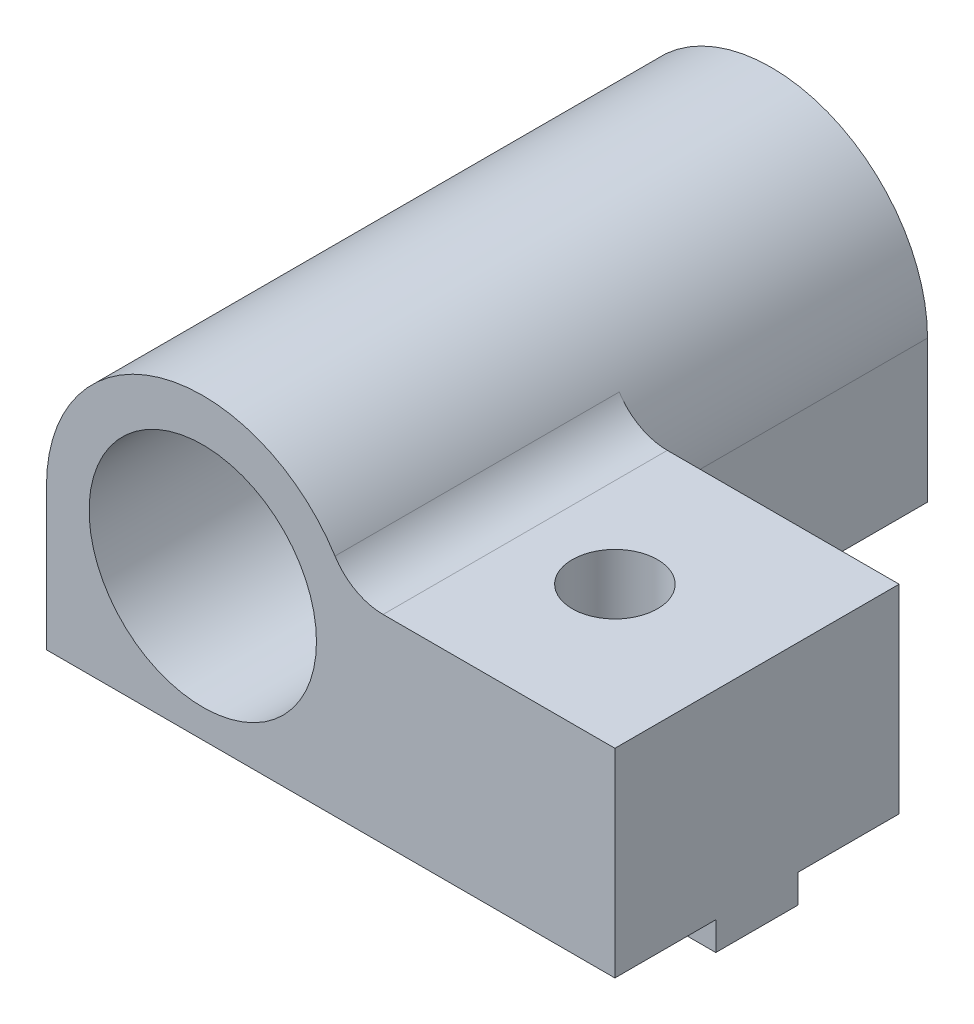
from build123d import *

# Parameters (mm, degrees)
SKETCH1_R                       = 4
MAIN_DEPTH                      = 10
SKETCH3_W                       = 20
SKETCH3_H                       = 2.9
MAKERBEAMRECTANGULARGUIDE_DEPTH = 1
SKETCH4_R                       = 1.5
MAKERBEAMFIXHOLE_DEPTH          = 20.345542122
FILLET1_R                       = 2
SKETCH5_R                       = 4
BOSS_EXTRUDE1_DEPTH             = 10
SKETCH6_W                       = 46.055005367
SKETCH6_H                       = 38.791045171
CUT_EXTRUDE1_DEPTH              = 30.516944286


with BuildPart() as part:
    # Sketch1 → Main (new body)
    with BuildSketch(Plane.XY):
        with BuildLine():
            Line((-5.5, 0), (-5.5, -5))
            Line((-5.5, -5), (14.5, -5))
            Line((14.5, -5), (14.5, 2))
            Line((14.5, 2), (5.123475383, 2))
            ThreePointArc((5.123475383, 2), (-1.017567048, 5.405049242), (-5.5, 0))
        make_face()
        Circle(SKETCH1_R, mode=Mode.SUBTRACT)
    extrude(amount=MAIN_DEPTH)

    # Sketch3 → MakerBeamRectangularGuide (add)
    with BuildSketch(Plane(origin=(0, -5, 0), x_dir=(-1, 0, 0), z_dir=(0, -1, 0))):
        with Locations((-4.5, -5)):
            Rectangle(SKETCH3_W, SKETCH3_H)
    extrude(amount=MAKERBEAMRECTANGULARGUIDE_DEPTH)

    # Sketch4 → MakerBeamFixHole (cut, through all)
    with BuildSketch(Plane(origin=(0, 2, 0), x_dir=(1, 0, 0), z_dir=(0, 1, 0))):
        with Locations((9.5, -5)):
            Circle(SKETCH4_R)
    extrude(amount=-MAKERBEAMFIXHOLE_DEPTH, mode=Mode.SUBTRACT)

    # Fillet1
    fillet1_edges = [part.edges().sort_by_distance(p)[0] for p in [
        (5.123475383, 2, 5),
    ]]
    fillet(fillet1_edges, radius=FILLET1_R)

    # Sketch5 → Boss-Extrude1 (add)
    with BuildSketch(Plane.XY.offset(10)):
        with BuildLine():
            Line((-5.5, -5), (5.5, -5))
            Line((5.5, -5), (5.5, 0))
            ThreePointArc((5.5, 0), (0, 5.5), (-5.5, 0))
            Line((-5.5, 0), (-5.5, -5))
        make_face()
        Circle(SKETCH5_R, mode=Mode.SUBTRACT)
    extrude(amount=BOSS_EXTRUDE1_DEPTH)


with BuildPart() as body_2:
    # Mirror1: mirrored copy
    add(part.part.mirror(Plane.XY.offset(-5)))


with BuildPart() as part_1:
    add(part.part)

    # Sketch6 → Cut-Extrude1 (cut, through all)
    with BuildSketch(Plane.XY.offset(-5)):
        with Locations((5.115796775, 3.309712685)):
            Rectangle(SKETCH6_W, SKETCH6_H)
    extrude(amount=CUT_EXTRUDE1_DEPTH, mode=Mode.SUBTRACT)


solid = body_2.part
